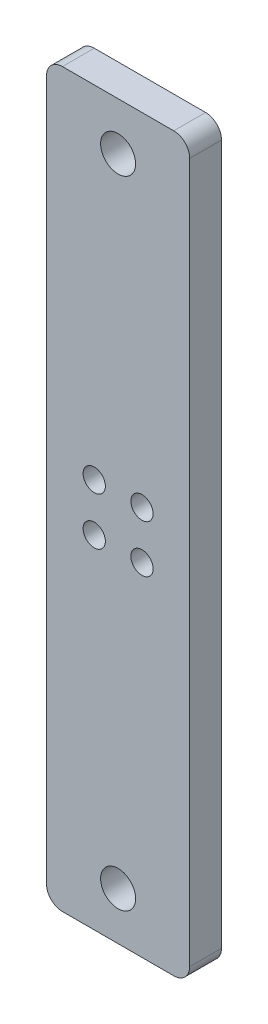
from build123d import *

# Parameters (mm, degrees)
IZIM1_W               = 45
IZIM1_H               = 230
TABAN_FLAN_1_DEPTH    = 10
IZIM6_R               = 3.5
KES_EKSTR_ZYON1_DEPTH = 26
IZIM7_R               = 5.5
KES_EKSTR_ZYON2_DEPTH = 10
RADYUS1_R             = 5


# Sheet-metal steps are written as plain solids
with BuildPart() as part:
    # Çizim1 → Taban-Flanş1 (new body)
    with BuildSketch(Plane.XY):
        Rectangle(IZIM1_W, IZIM1_H)
    extrude(amount=-TABAN_FLAN_1_DEPTH)

    # Çizim6 → Kes-Ekstrüzyon1 (cut)
    with BuildSketch(Plane.XY):
        with Locations((7.5, 7.5)):
            Circle(IZIM6_R)
        with Locations((-7.5, 7.5)):
            Circle(IZIM6_R)
        with Locations((7.5, -7.5)):
            Circle(IZIM6_R)
        with Locations((-7.5, -7.5)):
            Circle(IZIM6_R)
    extrude(amount=-KES_EKSTR_ZYON1_DEPTH, mode=Mode.SUBTRACT)

    # Çizim7 → Kes-Ekstrüzyon2 (cut)
    with BuildSketch(Plane.XY):
        with Locations((0, -100)):
            Circle(IZIM7_R)
        with Locations((0, 100)):
            Circle(IZIM7_R)
    extrude(amount=-KES_EKSTR_ZYON2_DEPTH, mode=Mode.SUBTRACT)

    # Radyus1
    radyus1_edges = [part.edges().sort_by_distance(p)[0] for p in [
        (22.5, -115, -5),
        (-22.5, -115, -5),
        (-22.5, 115, -5),
        (22.5, 115, -5),
    ]]
    fillet(radyus1_edges, radius=RADYUS1_R)


solid = part.part
